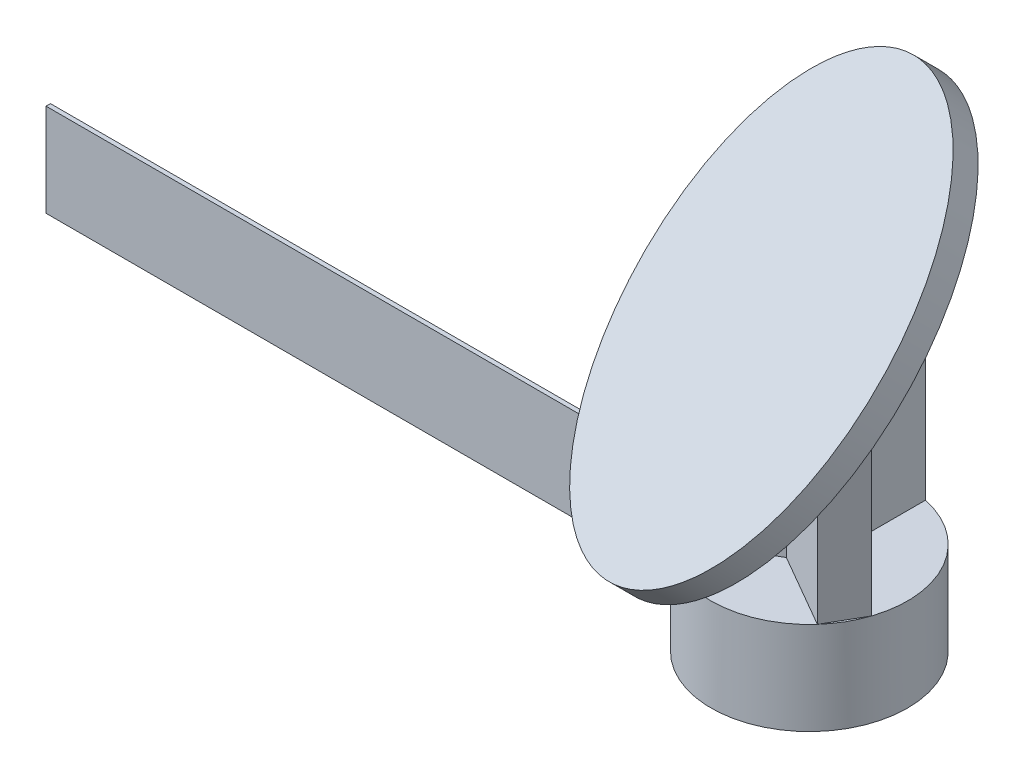
from build123d import *

# Parameters (mm, degrees)
SKETCH1_R               = 22.225
BOSS_EXTRUDE1_DEPTH     = 21
SKETCH3_R               = 10
CUT_EXTRUDE1_DEPTH      = 7
BOSS_EXTRUDE2_DEPTH     = 71
SKETCH5_W               = 150
SKETCH5_H               = 180
CUT_EXTRUDE2_DEPTH      = 72
SKETCH6_RX              = 48.683272643
SKETCH6_RY              = 26.408297454
BOSS_EXTRUDE3_DEPTH     = 8
BOSS_EXTRUDE4_OUTLINE_W = 150.225
BOSS_EXTRUDE4_OUTLINE_H = 1
BOSS_EXTRUDE4_DEPTH     = 21


# Read off the part's stored shape, not the designer's step: Boss-Extrude4
with BuildPart() as part:
    # Sketch1 → Boss-Extrude1 (new body)
    with BuildSketch(Plane(origin=(0, 0, 0), x_dir=(1, 0, 0), z_dir=(0, 1, 0))):
        with Locations(Location((0, 0, 0), (0, 0, 90))):
            Circle(SKETCH1_R)
    extrude(amount=BOSS_EXTRUDE1_DEPTH)

    # Sketch3 → Cut-Extrude1 (cut)
    with BuildSketch(Plane.XZ):
        with Locations(Location((0, 0, 0), (0, 0, 270))):
            Circle(SKETCH3_R)
    extrude(amount=-CUT_EXTRUDE1_DEPTH, mode=Mode.SUBTRACT)

    # Sketch4 → Boss-Extrude2 (add)
    with BuildSketch(Plane(origin=(0, 21, 0), x_dir=(1, 0, 0), z_dir=(0, 1, 0))):
        Polygon((0, 0), (-4.5, 0), (-4.5, 2.598076211), (-21.098752445, -6.985217981), (-16.598752445, -14.779446615), (0, -5.196152423), (-2.25, -3.897114317), align=None)
        Polygon((4.5, 0), (0, 0), (2.25, -3.897114317), (0, -5.196152423), (16.598752445, -14.779446615), (21.098752445, -6.985217981), (4.5, 2.598076211), align=None)
        Polygon((-2.25, 3.897114317), (0, 0), (2.25, 3.897114317), (4.5, 2.598076211), (4.5, 21.764664597), (-4.5, 21.764664597), (-4.5, 2.598076211), align=None)
        Polygon((2.25, -3.897114317), (0, 0), (-2.25, -3.897114317), (0, -5.196152423), align=None)
        Polygon((-4.5, 2.598076211), (-4.5, 0), (0, 0), (-2.25, 3.897114317), align=None)
        Polygon((2.25, 3.897114317), (0, 0), (4.5, 0), (4.5, 2.598076211), align=None)
    extrude(amount=BOSS_EXTRUDE2_DEPTH)

    # Sketch5 → Cut-Extrude2 (cut)
    with BuildSketch(Plane(origin=(0, 35.117667702, 35.117667702), x_dir=(-1, 0, 0), z_dir=(0, -0.7071067811865488, -0.7071067811865464))):
        Rectangle(SKETCH5_W, SKETCH5_H)
    extrude(amount=-CUT_EXTRUDE2_DEPTH, mode=Mode.SUBTRACT)

    # Sketch6 → Boss-Extrude3 (add)
    with BuildSketch(Plane(origin=(0, 35.117667702, 35.117667702), x_dir=(1, 0, 0), z_dir=(0, 0.7071067811865487, 0.7071067811865464))):
        with Locations(Location((0, 42.315412714), (0, 0, 90))):
            Ellipse(SKETCH6_RX, SKETCH6_RY)
    extrude(amount=BOSS_EXTRUDE3_DEPTH)

    # Boss-Extrude4 outline → Boss-Extrude4 (add)
    with BuildSketch(Plane(origin=(0, 0, 0), x_dir=(1, 0, 0), z_dir=(0, 1, 0))):
        with Locations((-97.1125, 0)):
            Rectangle(BOSS_EXTRUDE4_OUTLINE_W, BOSS_EXTRUDE4_OUTLINE_H)
    extrude(amount=BOSS_EXTRUDE4_DEPTH)


solid = part.part
